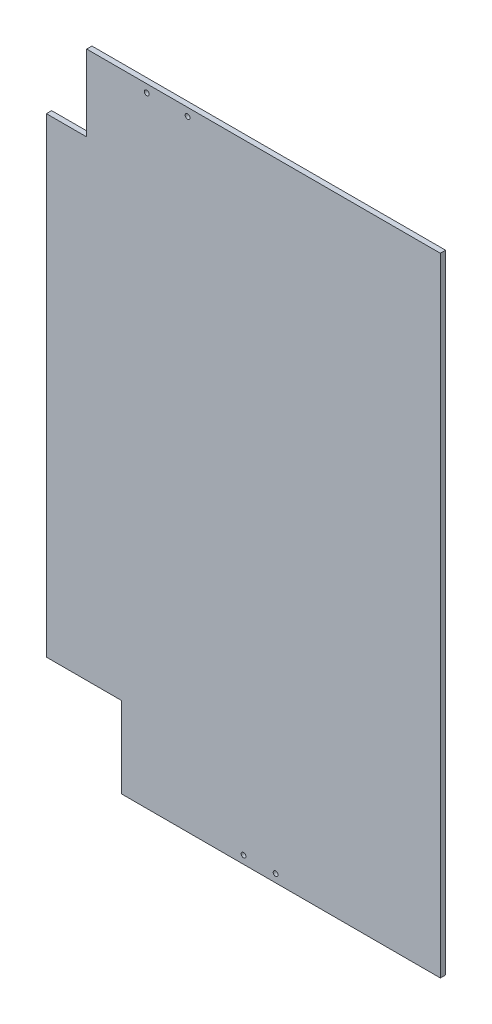
from build123d import *

# Parameters (mm, degrees)
BOSS_EXTRUDE1_DEPTH = 3.3
SKETCH2_R           = 1.5
CUT_EXTRUDE1_DEPTH  = 418.013500605
SKETCH5_W           = 31.32455923
SKETCH5_H           = 266
CUT_EXTRUDE4_DEPTH  = 10


with BuildPart() as part:
    # Sketch1 → Boss-Extrude1 (new body)
    with BuildSketch(Plane.XY):
        Polygon((-5.782297403, 1), (-5.782297403, -13), (25.5, -13), (25.5, -225), (-5.82455923, -225), (-5.82455923, -265), (72.438763187, -265), (72.438763187, -315.7), (272.438763187, -315.7), (272.438763187, 77.7), (50.748117859, 77.7), (50.748117859, 30), (25.5, 30), (25.5, 1), align=None)
    extrude(amount=BOSS_EXTRUDE1_DEPTH)

    # Sketch2 → Cut-Extrude1 (cut, through all)
    with BuildSketch(Plane(origin=(0, 0, 0), x_dir=(-1, 0, 0), z_dir=(0, 0, -1))):
        with Locations((-113.998383462, 72.7)):
            Circle(SKETCH2_R)
        with Locations((-88.397045893, 72.7)):
            Circle(SKETCH2_R)
        with Locations((-169.168895948, -310.7)):
            Circle(SKETCH2_R)
        with Locations((-149.084447974, -310.7)):
            Circle(SKETCH2_R)
    extrude(amount=-CUT_EXTRUDE1_DEPTH, mode=Mode.SUBTRACT)

    # Sketch5 → Cut-Extrude4 (cut)
    with BuildSketch(Plane(origin=(0, 0, 0), x_dir=(-1, 0, 0), z_dir=(0, 0, -1))):
        with Locations((-9.837720385, -132)):
            Rectangle(SKETCH5_W, SKETCH5_H)
    extrude(amount=-CUT_EXTRUDE4_DEPTH, mode=Mode.SUBTRACT)


solid = part.part
